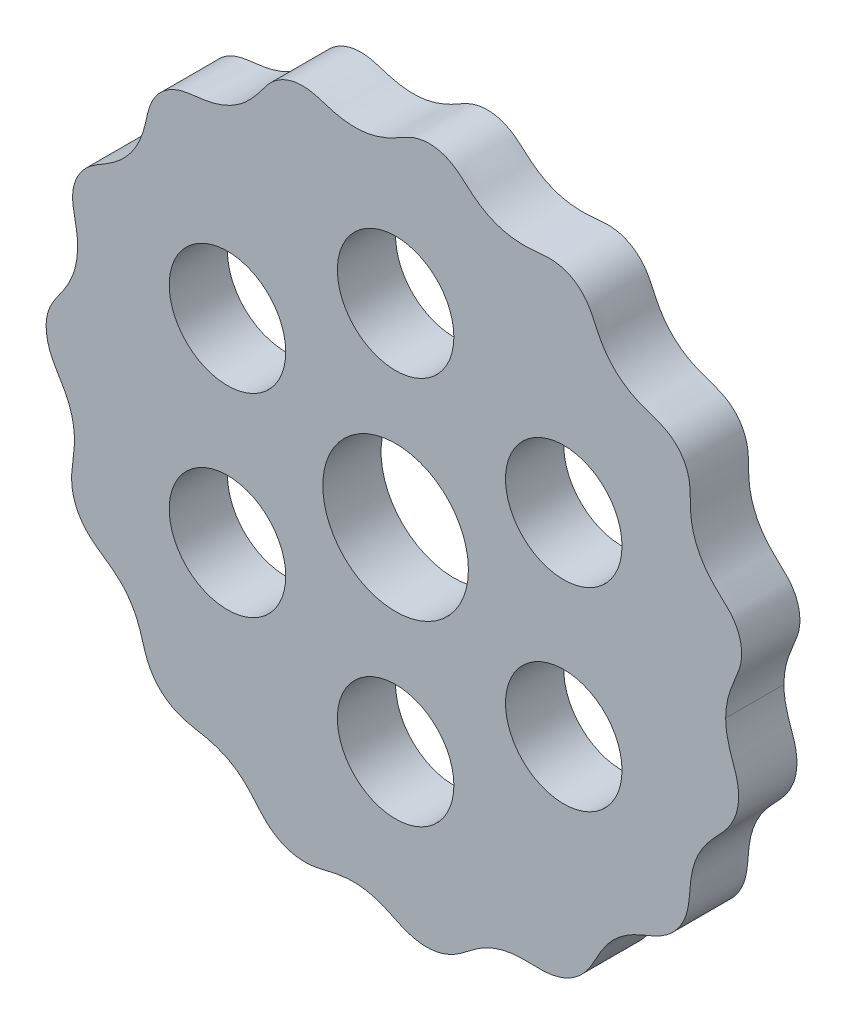
from build123d import *

# Parameters (mm, degrees)
BOSS_EXTRUDE1_DEPTH = 6
SKETCH2_R           = 7.5
SKETCH2_R_2         = 6
CUT_EXTRUDE1_DEPTH  = 52.25948641


# Read off the part's stored shape, not the designer's step: Boss-Extrude1
with BuildPart() as part:
    # Boss-Extrude1 outline → Boss-Extrude1 (new body)
    with BuildSketch(Plane.XY):
        with BuildLine():
            add(Edge.make_bspline(
                [(-36.000022071, -1e-09), (-36.000006539, -0.035587452), (-35.999356636, -0.089218667), (-35.997227513, -0.182583997), (-35.992470146, -0.294036465), (-35.987393491, -0.379294542), (-35.979472477, -0.4829647), (-35.967450824, -0.607434227), (-35.949768503, -0.754373952), (-35.924578979, -0.920719796), (-35.894450552, -1.086266226), (-35.833183591, -1.374377474), (-35.721589049, -1.780421689), (-35.534784872, -2.28560963), (-35.247075786, -2.874253985), (-34.922991377, -3.432177376), (-34.588133202, -3.972383055), (-34.224007358, -4.578345737), (-33.857454073, -5.265421073), (-33.548423709, -5.991564998), (-33.314301573, -6.755005415), (-33.151780812, -7.56287005), (-33.070133533, -8.409546674), (-33.08542821, -9.384148795), (-33.213783726, -10.473368141), (-33.389119893, -11.636624786), (-33.408835286, -12.900934492), (-33.137676238, -14.18757277), (-32.549402683, -15.412326675), (-31.796412626, -16.327160653), (-31.028030053, -16.971180521), (-30.21749304, -17.54019009), (-29.32220707, -18.141964588), (-28.343226561, -18.931115427), (-27.459962825, -19.959232839), (-26.812793321, -21.063541026), (-26.37840106, -22.112654619), (-26.063729205, -23.145184687), (-25.750360302, -24.26118093), (-25.253769253, -25.40442205), (-24.483267917, -26.458584069), (-23.443413942, -27.333361153), (-22.377073847, -27.85977713), (-21.403154828, -28.133489566), (-20.578191269, -28.291987687), (-19.91742759, -28.411616883), (-19.025788694, -28.600339343), (-17.989906841, -28.915848953), (-16.92141772, -29.429963589), (-15.884657222, -30.181179694), (-15.053962466, -30.980648334), (-14.340706418, -31.813124408), (-13.590418386, -32.707350586), (-12.65892181, -33.535322421), (-11.516384651, -34.165333678), (-10.351711516, -34.480165598), (-9.304847568, -34.541202573), (-8.264018409, -34.44193939), (-7.245672799, -34.210332689), (-6.038238425, -33.896756845), (-4.643041784, -33.720227028), (-3.299335315, -33.792453123), (-2.052868038, -34.08560343), (-0.977135494, -34.500902921), (-0.007585897, -34.974192771), (1.026099548, -35.459663922), (2.187222264, -35.803412833), (3.471635719, -35.891631731), (4.844761663, -35.652873975), (5.963324406, -35.152918981), (6.823988837, -34.558039048), (7.64834936, -33.918404613), (8.483955132, -33.290371294), (9.531295505, -32.667593847), (10.783242149, -32.199106607), (12.042089926, -31.96589489), (13.203429782, -31.915365785), (14.281066545, -31.956843007), (15.414541753, -31.972222629), (16.595487591, -31.808607453), (17.795027211, -31.364270422), (18.96231032, -30.572067684), (19.899988876, -29.511428197), (20.569896959, -28.279993203), (21.234699405, -27.030985094), (22.038544046, -25.920270386), (22.989454961, -24.995946501), (24.049478278, -24.276015055), (25.108257862, -23.756762556), (26.127228462, -23.353951263), (27.172050965, -22.894159422), (28.174008145, -22.248584355), (29.072950361, -21.339980415), (29.815909964, -20.098915622), (30.216029312, -18.703671687), (30.299098936, -17.270978276), (30.426138338, -15.843848461), (30.737528473, -14.527047862), (31.264283575, -13.301382566), (31.985453232, -12.20001847), (32.783166916, -11.297243572), (33.553874863, -10.518298008), (34.276881152, -9.667858889), (34.868380563, -8.69375245), (35.276838353, -7.510731958), (35.390311186, -6.273385109), (35.256159011, -5.160013203), (34.999450461, -4.256632701), (34.744362928, -3.540516662), (34.511631816, -2.88157748), (34.321310775, -2.273011471), (34.185359231, -1.727046967), (34.104150011, -1.289263544), (34.05942323, -0.964557766), (34.036564633, -0.755399254), (34.021867684, -0.586951338), (34.010799335, -0.420382149), (34.003412267, -0.255908549), (34.000622184, -0.107077692), (33.999989814, -0.03550668), (33.999977833, 0)],
                knots=[0.072382317, 0.072382317, 0.072382317, 0.072382317, 0.072382317, 0.073619763, 0.07424218, 0.074864597, 0.075487013, 0.07610943, 0.077354263, 0.078599097, 0.07984393, 0.081088763, 0.082333597, 0.08731247, 0.092291343, 0.096992953, 0.101694562, 0.106396171, 0.11109778, 0.117908019, 0.124718258, 0.129700158, 0.134682058, 0.142258834, 0.14983561, 0.158472746, 0.167109882, 0.177067368, 0.187026629, 0.196985795, 0.206942075, 0.211776985, 0.216611895, 0.226281715, 0.238870292, 0.248835473, 0.256425389, 0.264015305, 0.272387803, 0.280760302, 0.290718221, 0.300677054, 0.310635488, 0.320593217, 0.325559752, 0.330526286, 0.335492821, 0.340459355, 0.352521652, 0.362485245, 0.370339946, 0.378194647, 0.386552924, 0.394911201, 0.404869326, 0.414828124, 0.424786697, 0.430258328, 0.435729959, 0.445687503, 0.455645047, 0.467172835, 0.477137474, 0.485256867, 0.49337626, 0.501219177, 0.509062093, 0.519020399, 0.528979191, 0.538937768, 0.549910891, 0.554889185, 0.559867479, 0.569824066, 0.580824261, 0.590788577, 0.599172582, 0.607556588, 0.615134639, 0.62271269, 0.632670614, 0.642629792, 0.652588734, 0.664092162, 0.674047572, 0.684002982, 0.694474441, 0.704439647, 0.713088534, 0.721737421, 0.729300483, 0.736863545, 0.746821711, 0.756780812, 0.766739611, 0.77927312, 0.789219434, 0.799165748, 0.809126753, 0.819089228, 0.82850518, 0.837921132, 0.844717977, 0.851514822, 0.861473356, 0.87143244, 0.881390828, 0.887922948, 0.894455068, 0.899169791, 0.903884515, 0.908599239, 0.913313963, 0.915805017, 0.917050543, 0.91829607, 0.919541597, 0.920787124, 0.922032651, 0.923267265, 0.923267265, 0.923267265, 0.923267265, 0.923267265], degree=4))
            add(Edge.make_bspline(
                [(33.999977833, 0), (33.999958239, 0.22818309), (34.016745993, 0.656452048), (34.088077317, 1.28168991), (34.266312251, 2.092336681), (34.510040257, 2.855003213), (34.829019647, 3.655019367), (35.208586367, 4.491504965), (35.597239211, 5.547564534), (35.725816912, 6.855865742), (35.464713485, 8.110900518), (34.877963966, 9.19851544), (34.079674982, 10.096706197), (33.173590998, 10.877434731), (32.21971336, 11.83718623), (31.352173876, 13.074517431), (30.740198603, 14.456709823), (30.406847124, 15.930656391), (30.33617591, 17.281661384), (30.362095386, 18.47759597), (30.221318691, 19.671137249), (29.806635027, 20.808609269), (29.086570751, 21.790268783), (28.125966438, 22.527297245), (27.030530466, 23.020947791), (25.885100219, 23.365483479), (24.623883328, 23.855841177), (23.329119318, 24.635034989), (22.209422135, 25.650469569), (21.306996945, 26.862551369), (20.694357137, 28.068642781), (20.231430294, 29.171730068), (19.615090818, 30.203587728), (18.771517888, 31.071996892), (17.71299561, 31.673408256), (16.534967103, 31.95314645), (15.333503658, 31.95604115), (14.146968114, 31.804865355), (12.795196519, 31.741407902), (11.295756169, 31.928631639), (9.860589898, 32.402953003), (8.544200593, 33.144907097), (7.49497706, 33.998698118), (6.623235887, 34.818052532), (5.638866329, 35.507966861), (4.515175104, 35.954956498), (3.307825117, 36.071008508), (2.126025466, 35.847917637), (1.034746619, 35.367513082), (0.019637335, 34.752126255), (-1.181483457, 34.144447772), (-2.621048822, 33.701815605), (-4.119460066, 33.54487888), (-5.619499353, 33.679533482), (-6.920476225, 34.024925412), (-8.041375256, 34.41577327), (-9.208980953, 34.657560719), (-10.411300212, 34.628596362), (-11.567697475, 34.262675834), (-12.573091027, 33.590594666), (-13.39150546, 32.710239776), (-14.073729787, 31.727529195), (-14.923119093, 30.674698217), (-16.057133774, 29.675993387), (-17.362892683, 28.914580125), (-18.790998994, 28.420635956), (-20.12652024, 28.202419717), (-21.318563507, 28.103571597), (-22.492936662, 27.849691287), (-23.58642007, 27.329803919), (-24.495801156, 26.520371159), (-25.139144078, 25.494755361), (-25.526223343, 24.356928917), (-25.74959268, 23.181721201), (-26.098827315, 21.874764062), (-26.73043206, 20.50193648), (-27.615448575, 19.276518379), (-28.720619905, 18.245880638), (-29.852712374, 17.504684087), (-30.901455132, 16.929497083), (-31.869584436, 16.217832342), (-32.654827572, 15.296232424), (-33.153732863, 14.185721674), (-33.321396563, 12.98667027), (-33.209657995, 11.790111974), (-32.935575288, 10.625738961), (-32.724577026, 9.289415514), (-32.74515342, 7.778347618), (-33.05751502, 6.299373595), (-33.649683986, 4.909033308), (-34.383935733, 3.772484088), (-35.107645663, 2.82024574), (-35.607878014, 1.939249691), (-35.880511616, 1.158822699), (-35.979380862, 0.565217161), (-36.000033882, 0.188775121), (-36.000022071, -1e-09)],
                knots=[0.117647585, 0.117647585, 0.117647585, 0.117647585, 0.117647585, 0.123712418, 0.129030178, 0.134347938, 0.139665699, 0.144983459, 0.151891156, 0.158798854, 0.169437032, 0.179415757, 0.185337291, 0.191258825, 0.201234407, 0.211209989, 0.221196437, 0.231182886, 0.241158156, 0.251133425, 0.257054833, 0.262976242, 0.272955006, 0.282933716, 0.288855305, 0.294776895, 0.304753065, 0.314729235, 0.324714672, 0.334700109, 0.344675782, 0.354651455, 0.360572828, 0.366494201, 0.376472979, 0.386451673, 0.392373324, 0.398294975, 0.408271669, 0.418248364, 0.428232558, 0.438216751, 0.448193113, 0.458169474, 0.464090817, 0.47001216, 0.479990949, 0.489936445, 0.495772174, 0.501607903, 0.511549628, 0.521491354, 0.531445712, 0.54140007, 0.551341671, 0.561283271, 0.567119001, 0.572954731, 0.58290022, 0.592879003, 0.598800361, 0.604721718, 0.614697699, 0.62467368, 0.634658414, 0.644643147, 0.654619699, 0.664596251, 0.67051787, 0.676439489, 0.686418191, 0.696396962, 0.702318352, 0.708239743, 0.718215179, 0.728190615, 0.738176624, 0.748162632, 0.758138479, 0.768114325, 0.774035886, 0.779957447, 0.789936165, 0.799914922, 0.80583635, 0.811757777, 0.821732949, 0.831708121, 0.841694877, 0.851681634, 0.861657011, 0.871632389, 0.877553898, 0.883475407, 0.888464773, 0.893482591, 0.893482591, 0.893482591, 0.893482591, 0.893482591], degree=4))
        make_face()
    extrude(amount=BOSS_EXTRUDE1_DEPTH)

    # Sketch2 → Cut-Extrude1 (cut, through all)
    with BuildSketch(Plane.XY.offset(6)):
        Circle(SKETCH2_R)
        with Locations((0, 20)):
            Circle(SKETCH2_R_2)
        with Locations((17.320508076, 10)):
            Circle(SKETCH2_R_2)
        with Locations((17.320508076, -10)):
            Circle(SKETCH2_R_2)
        with Locations((0, -20)):
            Circle(SKETCH2_R_2)
        with Locations((-17.320508076, -10)):
            Circle(SKETCH2_R_2)
        with Locations((-17.320508076, 10)):
            Circle(SKETCH2_R_2)
    extrude(amount=-CUT_EXTRUDE1_DEPTH, mode=Mode.SUBTRACT)


solid = part.part
